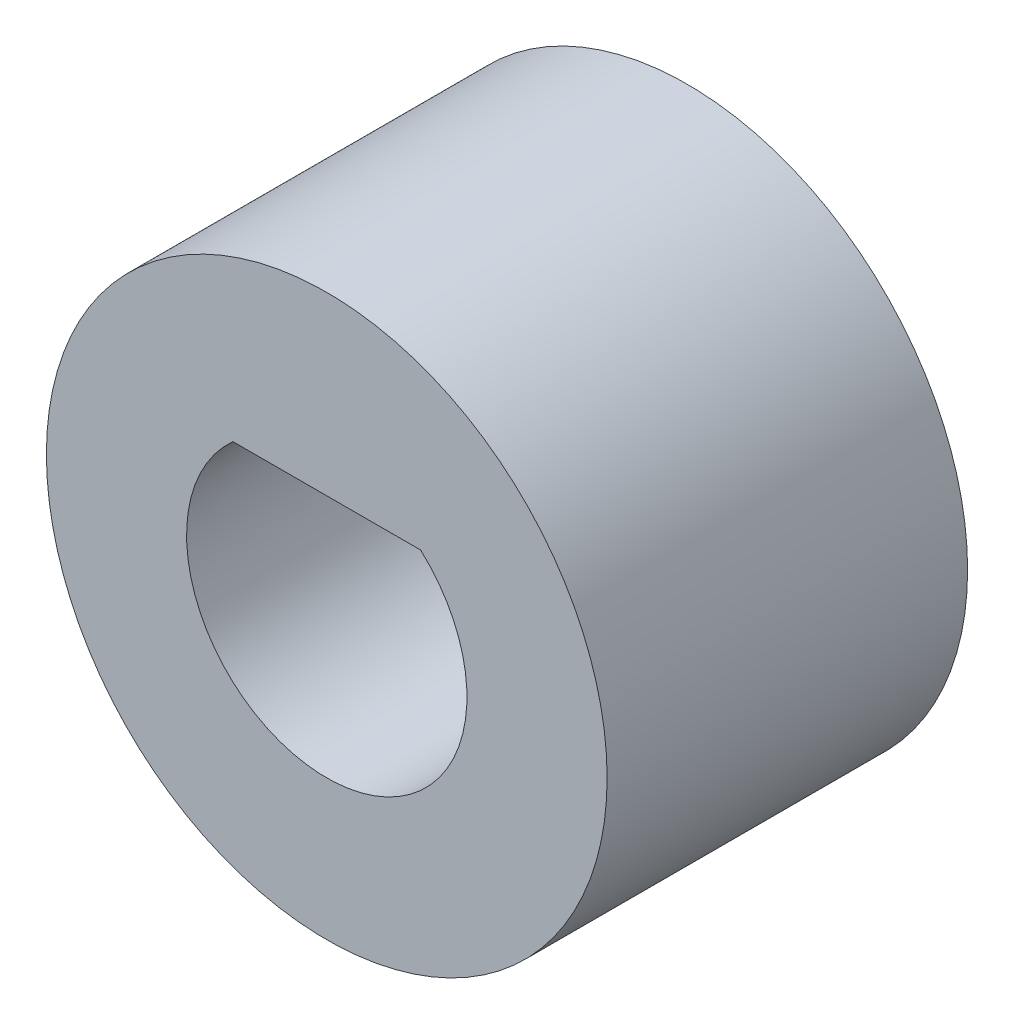
from build123d import *

# Parameters (mm, degrees)
ESQUISSE1_R        = 7
BOSS_EXTRU_1_DEPTH = 9


with BuildPart() as part:
    # Esquisse1 → Boss.-Extru.1 (new body)
    with BuildSketch(Plane.XY):
        Circle(ESQUISSE1_R)
        with BuildLine():
            Line((-2.343074903, 2.6), (2.343074903, 2.6))
            ThreePointArc((2.343074903, 2.6), (0, -3.5), (-2.343074903, 2.6))
        make_face(mode=Mode.SUBTRACT)
    extrude(amount=BOSS_EXTRU_1_DEPTH)


solid = part.part
